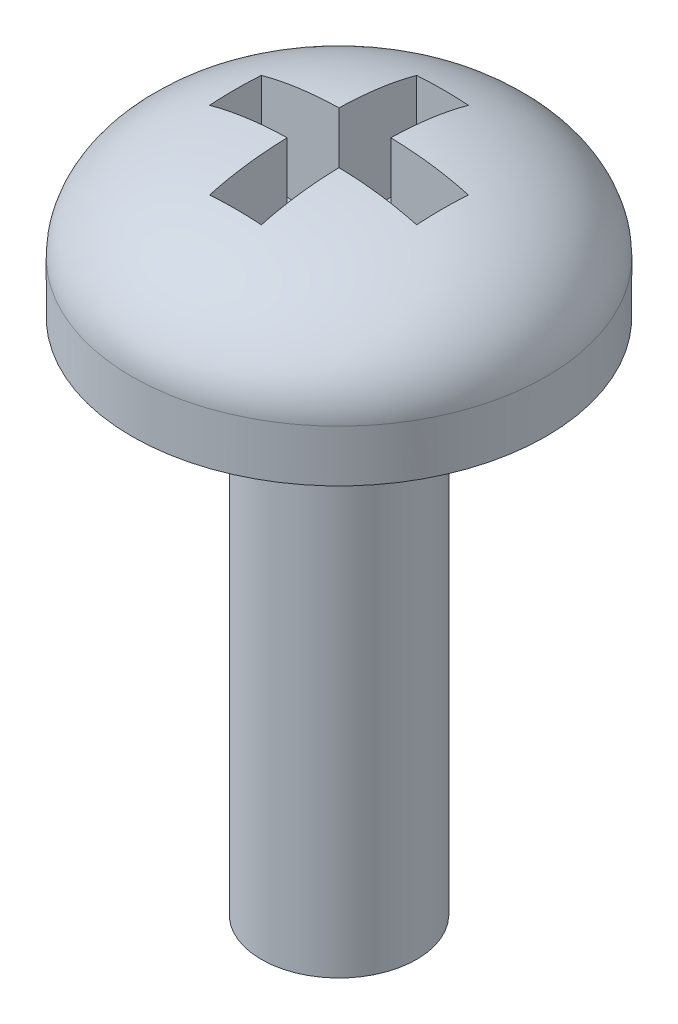
from build123d import *

# Parameters (mm, degrees)
SKETCH1_R           = 1.5
BOSS_EXTRUDE1_DEPTH = 10
SKETCH2_R           = 4
BOSS_EXTRUDE2_DEPTH = 3
SKETCH3_W           = 1.5
SKETCH3_H           = 1
SKETCH3_W_2         = 1
SKETCH3_H_2         = 1.5
CUT_EXTRUDE1_DEPTH  = 2
FILLET1_SIZE        = 2
FILLET1_SIZE_2      = 3.5


with BuildPart() as part:
    # Sketch1 → Boss-Extrude1 (new body)
    with BuildSketch(Plane(origin=(0, 0, 0), x_dir=(1, 0, 0), z_dir=(0, 1, 0))):
        with Locations(Location((0, 0, 0), (0, 0, 270))):
            Circle(SKETCH1_R)
    extrude(amount=BOSS_EXTRUDE1_DEPTH)

    # Sketch2 → Boss-Extrude2 (add)
    with BuildSketch(Plane(origin=(0, 10, 0), x_dir=(1, 0, 0), z_dir=(0, 1, 0))):
        with Locations(Location((0, 0, 0), (0, 0, 270))):
            Circle(SKETCH2_R)
    extrude(amount=BOSS_EXTRUDE2_DEPTH)

    # Sketch3 → Cut-Extrude1 (cut)
    with BuildSketch(Plane(origin=(0, 13, 0), x_dir=(1, 0, 0), z_dir=(0, 1, 0))):
        with Locations((-1.25, 0)):
            Rectangle(SKETCH3_W, SKETCH3_H)
        Rectangle(SKETCH3_W_2, SKETCH3_H)
        with Locations((0, 1.25)):
            Rectangle(SKETCH3_W_2, SKETCH3_H_2)
        with Locations((1.25, 0)):
            Rectangle(SKETCH3_W, SKETCH3_H)
        with Locations((0, -1.25)):
            Rectangle(SKETCH3_W_2, SKETCH3_H_2)
    extrude(amount=-CUT_EXTRUDE1_DEPTH, mode=Mode.SUBTRACT)

    # Fillet1
    # an asymmetric fillet: 3.5, 2 mm, written as the material it takes off along each edge
    with BuildSketch(Plane(origin=(0, 13, 0), x_dir=(0, 0, 1), z_dir=(-1, 0, 0))) as fillet1_piece_1:
        with BuildLine():
            Bezier((4, -FILLET1_SIZE), (4, 0), (4 - FILLET1_SIZE_2, 0), weights=[1, 0.707106781, 1])
            Line((4 - FILLET1_SIZE_2, 0), (4, 0))
            Line((4, 0), (4, -FILLET1_SIZE))
        make_face()
    revolve(axis=Axis((0, 13, 0), (0, 1, 0)), mode=Mode.SUBTRACT)


solid = part.part
